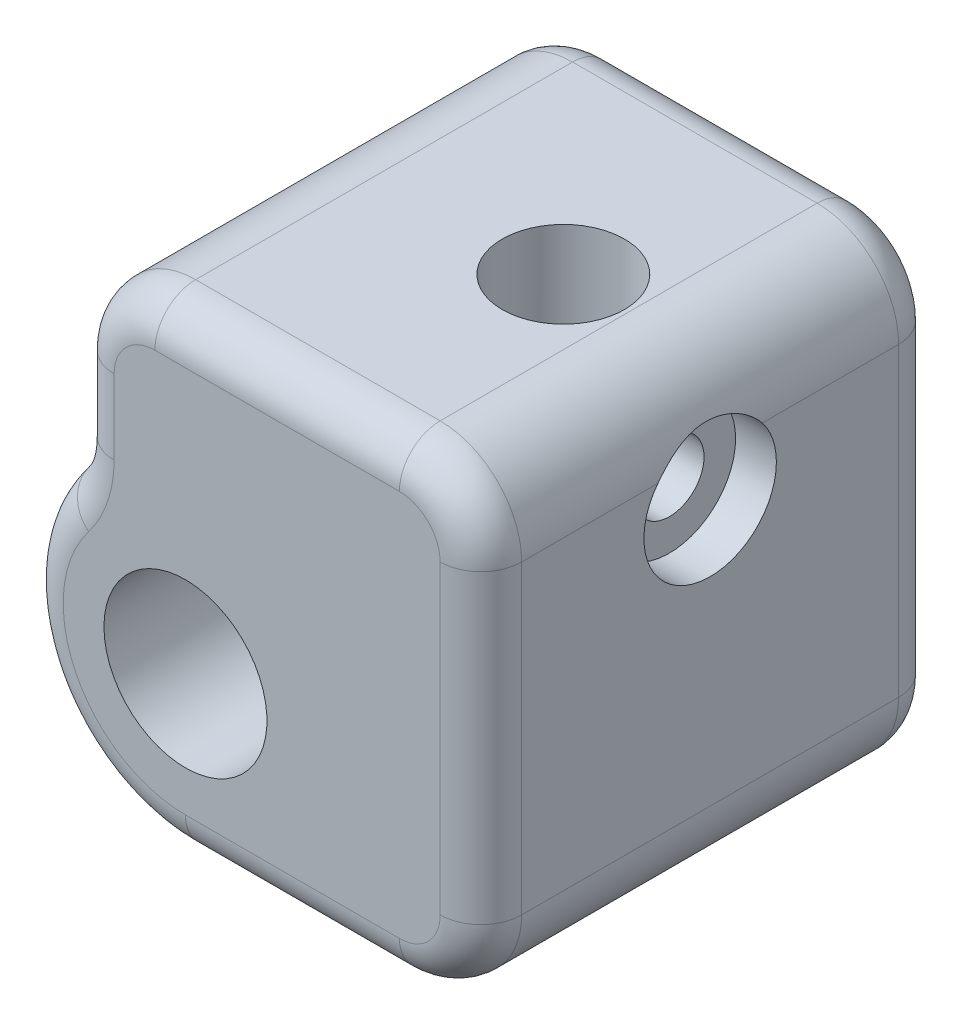
from build123d import *

# Parameters (mm, degrees)
ESQUISSE1_R                                     = 4
BOSS_EXTRU_1_DEPTH                              = 11.25
ENL_V_START                                     = 4
ESQUISSE2_R                                     = 3
ENL_V_MAT_EXTRU_1_DEPTH                         = 26.824610856
CHAMBRAGE_POUR_VIS_T_TE_CYLINDRIQUE_D           = 3.4
CHAMBRAGE_POUR_VIS_T_TE_CYLINDRIQUE_CBORE_D     = 6.5
CHAMBRAGE_POUR_VIS_T_TE_CYLINDRIQUE_CBORE_DEPTH = 2
ENL_V_MAT_EXTRU_6_DEPTH                         = 2.5
CONG_3_R                                        = 4
CONG_4_R                                        = 2


with BuildPart() as part:
    # Esquisse1 → Boss.-Extru.1 (new, symmetric)
    with BuildSketch(Plane.XY):
        with BuildLine():
            Line((-12.79525785, 23), (7.20474215, 23))
            Line((7.20474215, 23), (7.20474215, 0))
            Line((7.20474215, 0), (-7.29525785, 0))
            ThreePointArc((-7.29525785, 0), (-14.72747825, 5.039915555), (-12.79525785, 13.809475019))
            Line((-12.79525785, 13.809475019), (-12.79525785, 23))
        make_face()
        with Locations(Location((-7.29525785, 8, 0), (0, 0, 180))):
            Circle(ESQUISSE1_R, mode=Mode.SUBTRACT)
    extrude(amount=BOSS_EXTRU_1_DEPTH, both=True)

    # Esquisse2 → Enlèv. mat.-Extru.1 (cut, through all)
    with BuildSketch(Plane(origin=(0, 0, 0), x_dir=(1, 0, 0), z_dir=(0, 1, 0)).offset(ENL_V_START)):
        with Locations(Location((0, 0, 0), (0, 0, 270))):
            Circle(ESQUISSE2_R)
    extrude(amount=ENL_V_MAT_EXTRU_1_DEPTH, mode=Mode.SUBTRACT)

    # Chambrage pour vis à tête cylindrique à 6 pans creux (ou vis CHC) M31 (through all)
    with Locations(Plane(origin=(7.20474215, 0, 0), x_dir=(0, 0, -1), z_dir=(1, 0, 0))):
        with Locations((0, 17)):
            CounterBoreHole(CHAMBRAGE_POUR_VIS_T_TE_CYLINDRIQUE_D / 2, CHAMBRAGE_POUR_VIS_T_TE_CYLINDRIQUE_CBORE_D / 2, CHAMBRAGE_POUR_VIS_T_TE_CYLINDRIQUE_CBORE_DEPTH)

    # Esquisse10 → Enlèv. mat.-Extru.6 (cut)
    with BuildSketch(Plane.ZY.offset(12.79525785)):
        Polygon((1.58771324, 14.25), (3.175426481, 17), (1.58771324, 19.75), (-1.58771324, 19.75), (-3.175426481, 17), (-1.58771324, 14.25), align=None)
    extrude(amount=-ENL_V_MAT_EXTRU_6_DEPTH, mode=Mode.SUBTRACT)

    # Congé3
    # the kernel refuses this fillet: 4 mm, written as the material it adds along each edge
    with BuildSketch(Plane(origin=(-12.79525785, 13.809475019, -11.25), x_dir=(0, 1, 0), z_dir=(0, 0, 1))) as cong_3_piece_1_section:
        with BuildLine():
            CenterArc((1.52196413, 4), CONG_3_R, 232.341537994, 37.658462006)
            ThreePointArc((-0.92184892, 0.833333333), (-0.444719275, 0.434593145), (0, 0))
            Line((0, 0), (1.52196413, 0))
        make_face()
    cong_3_piece_1 = extrude(amount=22.5, mode=Mode.PRIVATE)
    cong_3_piece_1 = split(cong_3_piece_1, bisect_by=Plane(origin=(-12.787909879, 14.25, -6.543416313), z_dir=(0, 1, 0)), keep=Keep.TOP, mode=Mode.PRIVATE)
    cong_3_piece_1 = split(cong_3_piece_1, bisect_by=Plane(origin=(-12.787909879, 16.719497951, -3.013478547), z_dir=(0, -0.5000000000000004, -0.8660254037844384)), keep=Keep.TOP, mode=Mode.PRIVATE)
    add(cong_3_piece_1)
    with BuildSketch(Plane(origin=(-12.79525785, 13.809475019, -11.25), x_dir=(0, 1, 0), z_dir=(0, 0, 1))) as cong_3_piece_2_section:
        with BuildLine():
            CenterArc((1.52196413, 4), CONG_3_R, 232.341537994, 37.658462006)
            ThreePointArc((-0.92184892, 0.833333333), (-0.444719275, 0.434593145), (0, 0))
            Line((0, 0), (1.52196413, 0))
        make_face()
    cong_3_piece_2 = extrude(amount=22.5, mode=Mode.PRIVATE)
    cong_3_piece_2 = split(cong_3_piece_2, bisect_by=Plane(origin=(-13.040905226, 14.25, -6.25233642), z_dir=(0, -1, 0)), keep=Keep.TOP, mode=Mode.PRIVATE)
    cong_3_piece_2 = split(cong_3_piece_2, bisect_by=Plane(origin=(-13.040905226, 15.837208914, -2.504088734), z_dir=(0, -0.5000000000000004, -0.8660254037844384)), keep=Keep.TOP, mode=Mode.PRIVATE)
    add(cong_3_piece_2)
    with BuildSketch(Plane(origin=(-12.79525785, 13.809475019, -11.25), x_dir=(0, 1, 0), z_dir=(0, 0, 1))) as cong_3_piece_3_section:
        with BuildLine():
            CenterArc((1.52196413, 4), CONG_3_R, 232.341537994, 37.658462006)
            ThreePointArc((-0.92184892, 0.833333333), (-0.444719275, 0.434593145), (0, 0))
            Line((0, 0), (1.52196413, 0))
        make_face()
    cong_3_piece_3 = extrude(amount=22.5, mode=Mode.PRIVATE)
    cong_3_piece_3 = split(cong_3_piece_3, bisect_by=Plane(origin=(-13.005461126, 14.25, 0), z_dir=(0, -1, 0)), keep=Keep.TOP, mode=Mode.PRIVATE)
    cong_3_piece_3 = split(cong_3_piece_3, bisect_by=Plane(origin=(-13.005461126, 13.176729328, -0.968060129), z_dir=(0, 0.5000000000000004, 0.8660254037844384)), keep=Keep.TOP, mode=Mode.PRIVATE)
    cong_3_piece_3 = split(cong_3_piece_3, bisect_by=Plane(origin=(-13.005461126, 13.176729328, 0.968060129), z_dir=(0, 0.49999999999999994, -0.8660254037844387)), keep=Keep.TOP, mode=Mode.PRIVATE)
    add(cong_3_piece_3)
    with BuildSketch(Plane(origin=(-12.79525785, 13.809475019, -11.25), x_dir=(0, 1, 0), z_dir=(0, 0, 1))) as cong_3_piece_4_section:
        with BuildLine():
            CenterArc((1.52196413, 4), CONG_3_R, 232.341537994, 37.658462006)
            ThreePointArc((-0.92184892, 0.833333333), (-0.444719275, 0.434593145), (0, 0))
            Line((0, 0), (1.52196413, 0))
        make_face()
    cong_3_piece_4 = extrude(amount=22.5, mode=Mode.PRIVATE)
    cong_3_piece_4 = split(cong_3_piece_4, bisect_by=Plane(origin=(-12.787909879, 14.25, 6.543416313), z_dir=(0, 1, 0)), keep=Keep.TOP, mode=Mode.PRIVATE)
    cong_3_piece_4 = split(cong_3_piece_4, bisect_by=Plane(origin=(-12.787909879, 16.719497951, 3.013478547), z_dir=(0, -0.49999999999999994, 0.8660254037844387)), keep=Keep.TOP, mode=Mode.PRIVATE)
    add(cong_3_piece_4)
    with BuildSketch(Plane(origin=(-12.79525785, 13.809475019, -11.25), x_dir=(0, 1, 0), z_dir=(0, 0, 1))) as cong_3_piece_5_section:
        with BuildLine():
            CenterArc((1.52196413, 4), CONG_3_R, 232.341537994, 37.658462006)
            ThreePointArc((-0.92184892, 0.833333333), (-0.444719275, 0.434593145), (0, 0))
            Line((0, 0), (1.52196413, 0))
        make_face()
    cong_3_piece_5 = extrude(amount=22.5, mode=Mode.PRIVATE)
    cong_3_piece_5 = split(cong_3_piece_5, bisect_by=Plane(origin=(-13.040905226, 14.25, 6.25233642), z_dir=(0, -1, 0)), keep=Keep.TOP, mode=Mode.PRIVATE)
    cong_3_piece_5 = split(cong_3_piece_5, bisect_by=Plane(origin=(-13.040905226, 15.837208914, 2.504088734), z_dir=(0, -0.49999999999999994, 0.8660254037844387)), keep=Keep.TOP, mode=Mode.PRIVATE)
    add(cong_3_piece_5)
    # the kernel refuses this fillet: 4 mm, written as the material it takes off along each edge
    with BuildSketch(Plane(origin=(7.20474215, 0, -21.25), x_dir=(-1, 0, 0), z_dir=(0, 0, 1)), Plane(origin=(-12.79525785, 23, 21.25), x_dir=(0, -1, 0), z_dir=(0, 0, -1))) as cong_3_2_piece_1:
        with BuildLine():
            CenterArc((CONG_3_R, -CONG_3_R), CONG_3_R, 90, 90)
            Line((0, -CONG_3_R), (0, 0))
            Line((0, 0), (CONG_3_R, 0))
        make_face()
    extrude(amount=42.5, mode=Mode.SUBTRACT)
    with BuildSketch(Plane(origin=(7.20474215, 23, 21.25), x_dir=(0, -1, 0), z_dir=(0, 0, -1))) as cong_3_2_piece_2:
        with BuildLine():
            CenterArc((CONG_3_R, CONG_3_R), CONG_3_R, 180, 90)
            Line((0, CONG_3_R), (0, 0))
            Line((0, 0), (CONG_3_R, 0))
        make_face()
    extrude(amount=42.5, mode=Mode.SUBTRACT)

    # Congé4
    cong_4_edges = [part.edges().sort_by_distance(p)[0] for p in [
        (-2.04525785, 0, 11.25),
        (-2.79525785, 23, -11.25),
        (-2.79525785, 23, 11.25),
        (-2.04525785, 0, -11.25),
        (-12.79525785, 17.165719575, -11.25),
        (7.20474215, 11.5, -11.25),
        (-14.475125843, 4.471615724, -11.25),
        (-11.623684975, 21.828427125, -11.25),
        (6.033169275, 1.171572875, -11.25),
        (6.033169275, 21.828427125, -11.25),
        (7.20474215, 11.5, 11.25),
        (-12.79525785, 17.165719575, 11.25),
        (-14.475125843, 4.471615724, 11.25),
        (-11.623684975, 21.828427125, 11.25),
        (6.033169275, 1.171572875, 11.25),
        (6.033169275, 21.828427125, 11.25),
        (-13.009318953, 14.040444701, -11.25),
        (-13.009318953, 14.040444701, 11.25),
    ]]
    fillet(cong_4_edges, radius=CONG_4_R)


solid = part.part
